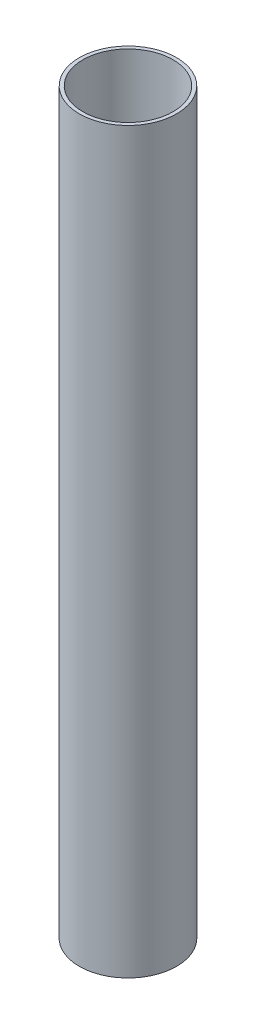
from build123d import *

# Parameters (mm, degrees)
SKETCH1_R           = 20.5
SKETCH1_R_2         = 19
BOSS_EXTRUDE1_DEPTH = 311


with BuildPart() as part:
    # Sketch1 → Boss-Extrude1 (new body)
    with BuildSketch(Plane(origin=(0, 0, 0), x_dir=(1, 0, 0), z_dir=(0, 1, 0))):
        Circle(SKETCH1_R)
        Circle(SKETCH1_R_2, mode=Mode.SUBTRACT)
    extrude(amount=BOSS_EXTRUDE1_DEPTH)


solid = part.part
